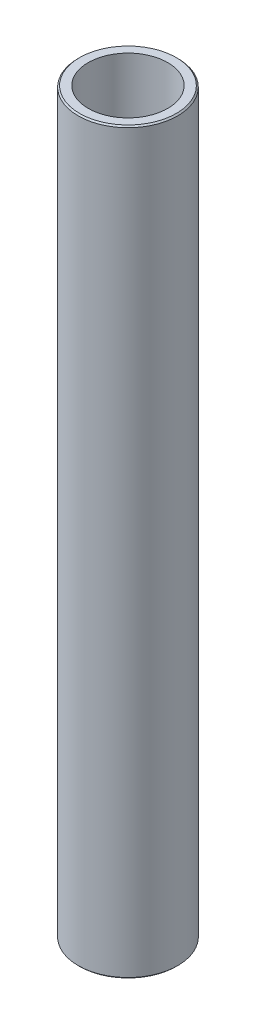
from build123d import *

# Parameters (mm, degrees)
SKETCH1_R           = 40
BOSS_EXTRUDE1_DEPTH = 593.670966847
SKETCH2_R           = 31.947574858
CUT_EXTRUDE1_DEPTH  = 597.359972565
CHAMFER1_SIZE       = 1.116258608


with BuildPart() as part:
    # Sketch1 → Boss-Extrude1 (new body)
    with BuildSketch(Plane(origin=(0, 0, 0), x_dir=(1, 0, 0), z_dir=(0, 1, 0))):
        Circle(SKETCH1_R)
    extrude(amount=BOSS_EXTRUDE1_DEPTH)

    # Sketch2 → Cut-Extrude1 (cut, through all)
    with BuildSketch(Plane(origin=(0, 0, 0), x_dir=(1, 0, 0), z_dir=(0, 1, 0))):
        Circle(SKETCH2_R)
    extrude(amount=CUT_EXTRUDE1_DEPTH, mode=Mode.SUBTRACT)

    # Chamfer1
    chamfer1_edges = [part.edges().sort_by_distance(p)[0] for p in [
        (-40, 593.670966847, 0),
        (-40, 0, 0),
    ]]
    chamfer(chamfer1_edges, length=CHAMFER1_SIZE)


solid = part.part
